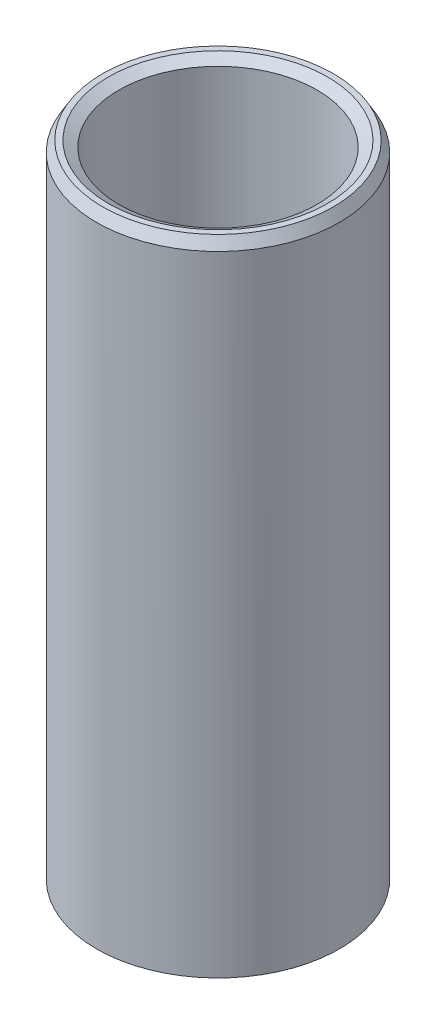
from build123d import *
from OCP.BRepFilletAPI import BRepFilletAPI_MakeChamfer

# Parameters (mm, degrees)
SKETCH1_R           = 45
BOSS_EXTRUDE1_DEPTH = 239.223480909
SKETCH2_R           = 36.732645143
CUT_EXTRUDE1_DEPTH  = 248.543680627
CHAMFER1_SIZE       = 3.88343358
CHAMFER1_SIZE2      = 2.242101423


with BuildPart() as part:
    # Sketch1 → Boss-Extrude1 (new body)
    with BuildSketch(Plane(origin=(0, 0, 0), x_dir=(1, 0, 0), z_dir=(0, 1, 0))):
        Circle(SKETCH1_R)
    extrude(amount=BOSS_EXTRUDE1_DEPTH)

    # Sketch2 → Cut-Extrude1 (cut, through all)
    with BuildSketch(Plane(origin=(0, 0, 0), x_dir=(1, 0, 0), z_dir=(0, 1, 0))):
        Circle(SKETCH2_R)
    extrude(amount=CUT_EXTRUDE1_DEPTH, mode=Mode.SUBTRACT)

    # Chamfer1: one chamfer whose edges measure the first distance from different faces: ONE call of the kernel's chamfer builder (chamfer() names one face for all edges)
    chamfer1_edges_1 = [part.edges().sort_by_distance(p)[0] for p in [
        (-36.732645143, 239.223480909, 0),
    ]]
    chamfer1_side_1 = [part.faces().sort_by_distance(p)[0] for p in [
        (-43.727207794, 239.223480909, 0),
    ]]
    chamfer1_edges_2 = [part.edges().sort_by_distance(p)[0] for p in [
        (-36.732645143, 0, 0),
    ]]
    chamfer1_side_2 = [part.faces().sort_by_distance(p)[0] for p in [
        (-36.732645143, 119.611740454, 0),
    ]]
    chamfer1_edges_3 = [part.edges().sort_by_distance(p)[0] for p in [
        (-45, 0, 0),
    ]]
    chamfer1_side_3 = [part.faces().sort_by_distance(p)[0] for p in [
        (-43.727207794, 0, 0),
    ]]
    chamfer1_edges_4 = [part.edges().sort_by_distance(p)[0] for p in [
        (-45, 239.223480909, 0),
    ]]
    chamfer1_side_4 = [part.faces().sort_by_distance(p)[0] for p in [
        (-45, 119.611740454, 0),
    ]]
    chamfer1 = BRepFilletAPI_MakeChamfer(part.part.solid().wrapped)
    for e in chamfer1_edges_1:
        chamfer1.Add(CHAMFER1_SIZE, CHAMFER1_SIZE2, e.wrapped, chamfer1_side_1[0].wrapped)  # the first distance lies on this face
    for e in chamfer1_edges_2:
        chamfer1.Add(CHAMFER1_SIZE, CHAMFER1_SIZE2, e.wrapped, chamfer1_side_2[0].wrapped)  # the first distance lies on this face
    for e in chamfer1_edges_3:
        chamfer1.Add(CHAMFER1_SIZE, CHAMFER1_SIZE2, e.wrapped, chamfer1_side_3[0].wrapped)  # the first distance lies on this face
    for e in chamfer1_edges_4:
        chamfer1.Add(CHAMFER1_SIZE, CHAMFER1_SIZE2, e.wrapped, chamfer1_side_4[0].wrapped)  # the first distance lies on this face
    add(Compound.cast(chamfer1.Shape()), mode=Mode.REPLACE)


solid = part.part
